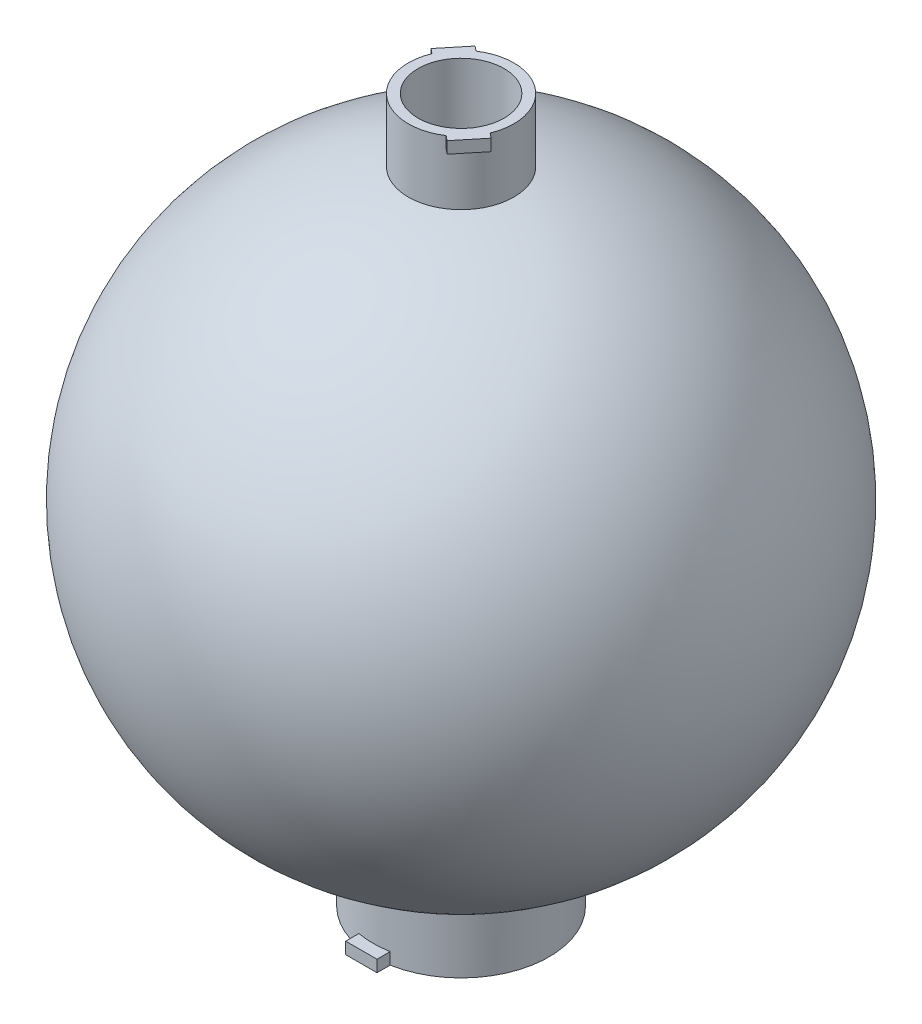
from build123d import *

# Parameters (mm, degrees)
BOSS_EXTRUDE1_DEPTH = 90
BOSS_EXTRUDE2_DEPTH = 3
SKETCH3_R           = 13.5
BOSS_EXTRUDE3_DEPTH = 90
BOSS_EXTRUDE4_START = -3
BOSS_EXTRUDE4_DEPTH = 3
SKETCH5_R           = 11
CUT_EXTRUDE1_DEPTH  = 200
SCALE1_SCALE        = 1.5
SKETCH6_R           = 25
CUT_EXTRUDE2_DEPTH  = 65
SCALE2_SCALE        = 0.6


# Read off the part's stored shape, not the designer's step: Shell4
with BuildPart() as part:
    # Sketch1 → Boss-Extrude1 (new body)
    with BuildSketch(Plane(origin=(0, 0, 0), x_dir=(1, 0, 0), z_dir=(0, 1, 0))):
        with BuildLine():
            ThreePointArc((-4, 22.141589825), (-22.5, 0), (-4, -22.141589825))
            Line((-4, -22.141589825), (-4, 22.141589825))
        make_face()
        with BuildLine():
            Line((-4, 22.141589825), (-4, -22.141589825))
            ThreePointArc((-4, -22.141589825), (0, -22.5), (4, -22.141589825))
            Line((4, -22.141589825), (4, 22.141589825))
            ThreePointArc((4, 22.141589825), (0, 22.5), (-4, 22.141589825))
        make_face()
        with BuildLine():
            Line((4, 22.141589825), (4, -22.141589825))
            ThreePointArc((4, -22.141589825), (17.26629665, -14.426538046), (22.5, 0))
            ThreePointArc((22.5, 0), (17.26629665, 14.426538046), (4, 22.141589825))
        make_face()
    extrude(amount=BOSS_EXTRUDE1_DEPTH)

    # Sketch1<3> → Boss-Extrude2 (add)
    with BuildSketch(Plane(origin=(0, 0, 0), x_dir=(1, 0, 0), z_dir=(0, 1, 0))):
        with BuildLine():
            Line((-4, 25.5), (-4, 22.141589825))
            ThreePointArc((-4, 22.141589825), (0, 22.5), (4, 22.141589825))
            Line((4, 22.141589825), (4, 25.5))
            Line((4, 25.5), (-4, 25.5))
        make_face()
        with BuildLine():
            Line((-4, -22.141589825), (-4, -25.5))
            Line((-4, -25.5), (4, -25.5))
            Line((4, -25.5), (4, -22.141589825))
            ThreePointArc((4, -22.141589825), (0, -22.5), (-4, -22.141589825))
        make_face()
    extrude(amount=BOSS_EXTRUDE2_DEPTH)

    # Sketch3 → Boss-Extrude3 (add)
    with BuildSketch(Plane(origin=(0, 90, 0), x_dir=(1, 0, 0), z_dir=(0, 1, 0))):
        with Locations(Location((0, 0, 0), (0, 0, 90))):
            Circle(SKETCH3_R)
    extrude(amount=BOSS_EXTRUDE3_DEPTH)

    # Sketch4 → Boss-Extrude4 (add)
    with BuildSketch(Plane(origin=(0, 180, 0), x_dir=(1, 0, 0), z_dir=(0, 1, 0)).offset(BOSS_EXTRUDE4_START)):
        with BuildLine():
            Line((-8.690152284, 12.277265708), (-13.755690181, 6.085309166))
            Line((-13.755690181, 6.085309166), (-12.345874566, 5.461628073))
            ThreePointArc((-12.345874566, 5.461628073), (-10.448926665, 8.5480952), (-7.799501781, 11.018973272))
            Line((-7.799501781, 11.018973272), (-8.690152284, 12.277265708))
        make_face()
        with BuildLine():
            ThreePointArc((-7.799501781, 11.018973272), (-7.62418516, 11.140996394), (-7.446959855, 11.260230411))
            Line((-7.446959855, 11.260230411), (-8.690152284, 12.277265708))
            Line((-8.690152284, 12.277265708), (-7.799501781, 11.018973272))
        make_face()
        with BuildLine():
            ThreePointArc((12.345874566, -5.461628073), (12.430742152, -5.265610084), (12.512497752, -5.068273869))
            Line((12.512497752, -5.068273869), (-7.446959855, 11.260230411))
            ThreePointArc((-7.446959855, 11.260230411), (-7.62418516, 11.140996394), (-7.799501781, 11.018973272))
            Line((-7.799501781, 11.018973272), (0, 0))
            Line((0, 0), (12.345874566, -5.461628073))
        make_face()
        with BuildLine():
            Line((0, 0), (7.799501781, -11.018973272))
            ThreePointArc((7.799501781, -11.018973272), (10.448926665, -8.5480952), (12.345874566, -5.461628073))
            Line((12.345874566, -5.461628073), (0, 0))
        make_face()
        with BuildLine():
            Line((-12.345874566, 5.461628073), (0, 0))
            Line((0, 0), (-7.799501781, 11.018973272))
            ThreePointArc((-7.799501781, 11.018973272), (-10.448926665, 8.5480952), (-12.345874566, 5.461628073))
        make_face()
        with BuildLine():
            Line((-12.512497752, 5.068273869), (7.446959855, -11.260230411))
            ThreePointArc((7.446959855, -11.260230411), (7.62418516, -11.140996394), (7.799501781, -11.018973272))
            Line((7.799501781, -11.018973272), (0, 0))
            Line((0, 0), (-12.345874566, 5.461628073))
            ThreePointArc((-12.345874566, 5.461628073), (-12.430742152, 5.265610084), (-12.512497752, 5.068273869))
        make_face()
        with BuildLine():
            Line((-13.755690181, 6.085309166), (-12.512497752, 5.068273869))
            ThreePointArc((-12.512497752, 5.068273869), (-12.430742152, 5.265610084), (-12.345874566, 5.461628073))
            Line((-12.345874566, 5.461628073), (-13.755690181, 6.085309166))
        make_face()
        with BuildLine():
            Line((12.345874566, -5.461628073), (13.755690181, -6.085309166))
            Line((13.755690181, -6.085309166), (12.512497752, -5.068273869))
            ThreePointArc((12.512497752, -5.068273869), (12.430742152, -5.265610084), (12.345874566, -5.461628073))
        make_face()
        with BuildLine():
            Line((7.799501781, -11.018973272), (8.690152284, -12.277265708))
            Line((8.690152284, -12.277265708), (13.755690181, -6.085309166))
            Line((13.755690181, -6.085309166), (12.345874566, -5.461628073))
            ThreePointArc((12.345874566, -5.461628073), (10.448926665, -8.5480952), (7.799501781, -11.018973272))
        make_face()
        with BuildLine():
            Line((7.446959855, -11.260230411), (8.690152284, -12.277265708))
            Line((8.690152284, -12.277265708), (7.799501781, -11.018973272))
            ThreePointArc((7.799501781, -11.018973272), (7.62418516, -11.140996394), (7.446959855, -11.260230411))
        make_face()
    extrude(amount=BOSS_EXTRUDE4_DEPTH)

    # Sketch2 one side → Revolve1 (revolve)
    with BuildSketch(Plane(origin=(0, 90, 0), x_dir=(1, 0, 0), z_dir=(0, 1, 0))):
        with BuildLine():
            Line((-22.5, 0), (22.5, 0))
            ThreePointArc((22.5, 0), (0, 22.5), (-22.5, 0))
        make_face()
        with BuildLine():
            Line((-75, 0), (75, 0))
            ThreePointArc((75, 0), (0, 75), (-75, 0))
        make_face()
        with BuildLine():
            ThreePointArc((-22.5, 0), (0, -22.5), (22.5, 0))
            Line((22.5, 0), (-22.5, 0))
        make_face()
    revolve(axis=Axis((-75, 90, 0), (1, 0, 0)))

    # Shell4 outline → Shell4 (revolve, cut)
    with BuildSketch(Plane.XY):
        with BuildLine():
            Line((6.499999977, 157.688625339), (6.5, 173))
            Line((6.5, 173), (0, 173))
            Line((0, 173), (0, 7))
            Line((0, 7), (15.5, 7))
            Line((15.5, 7), (15.499999978, 23.790106474))
            ThreePointArc((15.499999978, 23.790106474), (67.846911043, 94.560335727), (6.499999977, 157.688625339))
        make_face()
    revolve(axis=Axis((0, 0, 0), (0, 1, 0)), mode=Mode.SUBTRACT)

    # Sketch5 → Cut-Extrude1 (cut)
    with BuildSketch(Plane(origin=(0, 180, 0), x_dir=(1, 0, 0), z_dir=(0, 1, 0))):
        with Locations(Location((0, 0, 0), (0, 0, 270))):
            Circle(SKETCH5_R)
    extrude(amount=-CUT_EXTRUDE1_DEPTH, mode=Mode.SUBTRACT)


with BuildPart() as part_1:
    # Scale1: scaled about (-7.769e-06, 87.871063755, -1.7236e-05)
    add(part.part.scale(SCALE1_SCALE).moved(Location((3.884e-06, -43.935531877, 8.618e-06))))

    # Sketch6 → Cut-Extrude2 (cut)
    with BuildSketch(Plane.XZ.offset(43.93576905)):
        with Locations(Location((0, 0, 0), (0, 0, 270))):
            Circle(SKETCH6_R)
    extrude(amount=-CUT_EXTRUDE2_DEPTH, mode=Mode.SUBTRACT)


with BuildPart() as part_2:
    # Scale2: scaled about (-8.009e-06, 89.299768171, -1.5386e-05)
    add(part_1.part.scale(SCALE2_SCALE).moved(Location((-3.204e-06, 35.719907268, -6.154e-06))))


solid = part_2.part
